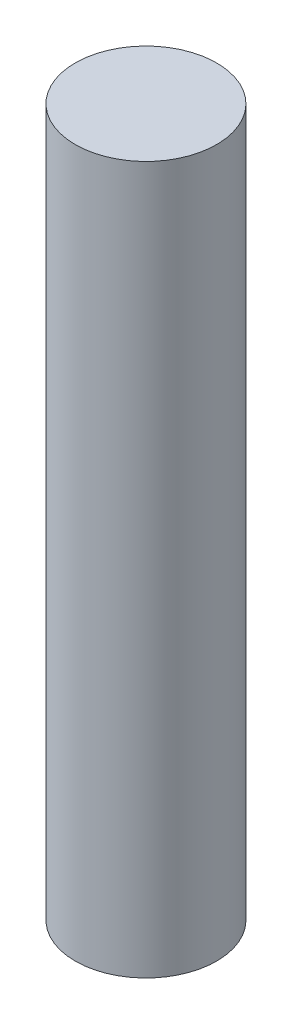
from build123d import *

# Parameters (mm, degrees)
SKETCH1_R           = 1
BOSS_EXTRUDE1_DEPTH = 10


with BuildPart() as part:
    # Sketch1 → Boss-Extrude1 (new body)
    with BuildSketch(Plane(origin=(0, 0, 0), x_dir=(1, 0, 0), z_dir=(0, 1, 0))):
        Circle(SKETCH1_R)
    extrude(amount=BOSS_EXTRUDE1_DEPTH)


solid = part.part
